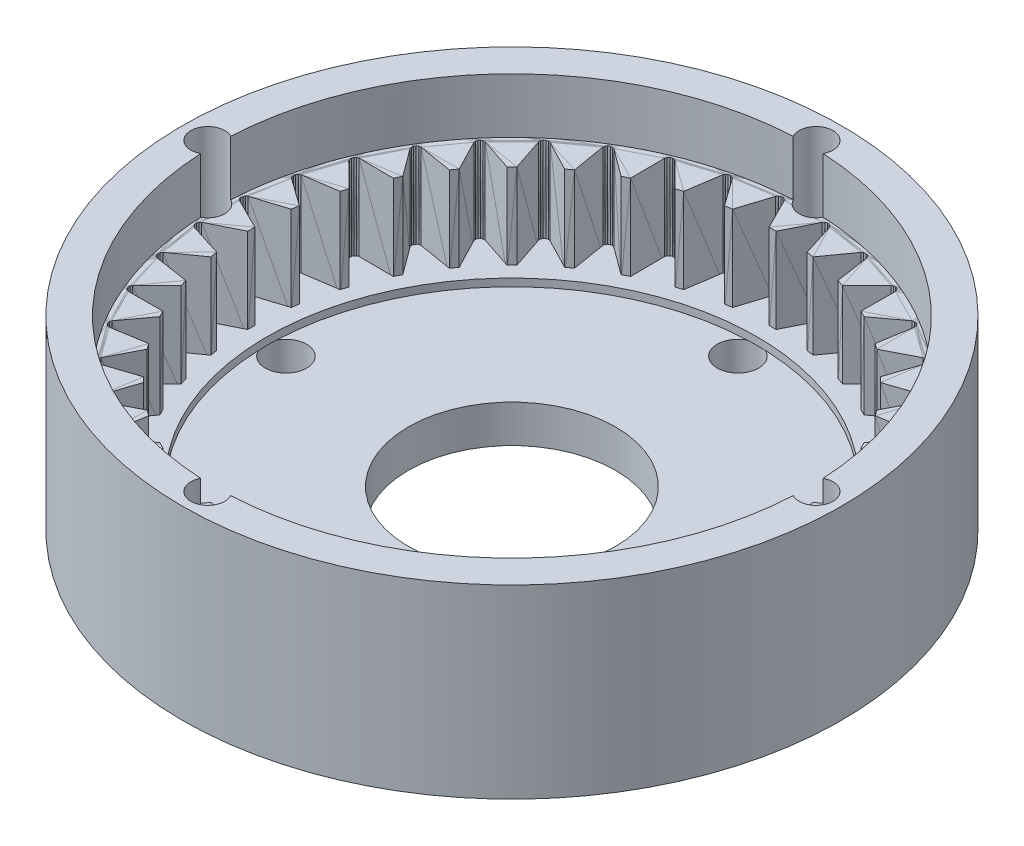
from build123d import *

# Parameters (mm, degrees)
SCALE_1_DEPTH            = 9.842519648
SKETCH_2_R               = 35
SKETCH_2_R_2             = 31.5
EXTRUDE_1_DEPTH          = 15.7
SKETCH_3_R               = 35
SKETCH_3_R_2             = 26
EXTRUDE_2_DEPTH          = 0.8
EXTRUDE_START            = -4
SKETCH_4_R               = 35
SKETCH_4_R_2             = 11
EXTRUDE_3_DEPTH          = 4
CUT_EXTRUDE_4_DEPTH      = 52.927738252
CUT_EXTRUDE_4_DEPTH_BACK = 52.927738252
SKETCH_5_R               = 1.8
SKETCH_7_R               = 2.2
CUT_EXTRUDE_5_DEPTH      = 4


with BuildPart() as part:
    # 缩放比例1: read off the stored shape, not the designer's step
    # 缩放比例1 outline → 缩放比例1 (new body)
    with BuildSketch(Plane(origin=(0, 0, 0), x_dir=(1, 0, 0), z_dir=(0, 1, 0))):
        Polygon((-28.350821231, 19.569159485), (-34.197649802, 4.152346446), (-32.210204517, -12.215718743), (-22.843792976, -25.785312755), (-8.244141645, -33.447798342), (8.244141645, -33.447798342), (22.843792976, -25.785312755), (32.210204517, -12.215718743), (34.44882168, 0), (34.197649802, 4.152346446), (28.350821231, 19.569159485), (16.009164392, 30.502915615), (0, 34.44882168), (-16.009164392, 30.502915615), align=None)
        Polygon((-31.149413553, -2.34892741), (-31.080524786, -2.156340997), (-30.938786222, -2.0088768), (-27.679521008, -0.37684556), (-27.679521008, 0.37684556), (-30.938786222, 2.0088768), (-31.080524786, 2.156340997), (-31.149413553, 2.34892741), (-31.133368611, 2.552833939), (-31.03519557, 2.732272333), (-30.87213554, 2.855748244), (-27.397691156, 3.957825174), (-27.279788628, 4.702237129), (-30.243620859, 6.824036973), (-30.360545497, 6.99185839), (-30.398461968, 7.192850171), (-30.350711313, 7.391735562), (-30.225681257, 7.553608157), (-30.045313179, 7.650056068), (-26.441240334, 8.1950413), (-26.208336931, 8.911843906), (-28.803755413, 11.471166363), (-28.892990667, 11.655213166), (-28.898994788, 11.859661026), (-28.820722946, 12.048629287), (-28.67190924, 12.18894904), (-28.478674358, 12.255992624), (-24.833719363, 12.230467109), (-24.491551449, 12.902010349), (-26.654649992, 15.835837985), (-26.713989791, 16.031577252), (-26.687941863, 16.234448412), (-26.581072598, 16.408844385), (-26.412139414, 16.524156672), (-26.210793294, 16.560147924), (-22.61470654, 15.964740305), (-22.17169822, 16.574488836), (-23.849216814, 19.810578669), (-23.877207423, 20.013190806), (-23.819741909, 20.209490322), (-23.686904751, 20.365021192), (-23.502012482, 20.452485478), (-23.297517328, 20.456536731), (-19.83884722, 19.305906608), (-19.305906608, 19.83884722), (-20.456536731, 23.297517328), (-20.452485478, 23.502012482), (-20.365021192, 23.686904751), (-20.209490322, 23.819741909), (-20.013190806, 23.877207423), (-19.810578669, 23.849216814), (-16.574488836, 22.17169822), (-15.964740305, 22.61470654), (-16.560147924, 26.210793294), (-16.524156672, 26.412139414), (-16.408844385, 26.581072598), (-16.234448412, 26.687941863), (-16.031577252, 26.713989791), (-15.835837985, 26.654649992), (-12.902010349, 24.491551449), (-12.230467109, 24.833719363), (-12.255992624, 28.478674358), (-12.18894904, 28.67190924), (-12.048629287, 28.820722946), (-11.859661026, 28.898994788), (-11.655213166, 28.892990667), (-11.471166363, 28.803755413), (-8.911843906, 26.208336931), (-8.1950413, 26.441240334), (-7.650056068, 30.045313179), (-7.553608157, 30.225681257), (-7.391735562, 30.350711313), (-7.192850171, 30.398461968), (-6.99185839, 30.360545497), (-6.824036973, 30.243620859), (-4.702237129, 27.279788628), (-3.957825174, 27.397691156), (-2.855748244, 30.87213554), (-2.732272333, 31.03519557), (-2.552833939, 31.133368611), (-2.34892741, 31.149413553), (-2.156340997, 31.080524786), (-2.0088768, 30.938786222), (-0.37684556, 27.679521008), (0.37684556, 27.679521008), (2.0088768, 30.938786222), (2.156340997, 31.080524786), (2.34892741, 31.149413553), (2.552833939, 31.133368611), (2.732272333, 31.03519557), (2.855748244, 30.87213554), (3.957825174, 27.397691156), (4.702237129, 27.279788628), (6.824036973, 30.243620859), (6.99185839, 30.360545497), (7.192850171, 30.398461968), (7.391735562, 30.350711313), (7.553608157, 30.225681257), (7.650056068, 30.045313179), (8.1950413, 26.441240334), (8.911843906, 26.208336931), (11.471166363, 28.803755413), (11.655213166, 28.892990667), (11.859661026, 28.898994788), (12.048629287, 28.820722946), (12.18894904, 28.67190924), (12.255992624, 28.478674358), (12.230467109, 24.833719363), (12.902010349, 24.491551449), (15.835837985, 26.654649992), (16.031577252, 26.713989791), (16.234448412, 26.687941863), (16.408844385, 26.581072598), (16.524156672, 26.412139414), (16.560147924, 26.210793294), (15.964740305, 22.61470654), (16.574488836, 22.17169822), (19.810578669, 23.849216814), (20.013190806, 23.877207423), (20.209490322, 23.819741909), (20.365021192, 23.686904751), (20.452485478, 23.502012482), (20.456536731, 23.297517328), (19.305906608, 19.83884722), (19.83884722, 19.305906608), (23.297517328, 20.456536731), (23.502012482, 20.452485478), (23.686904751, 20.365021192), (23.819741909, 20.209490322), (23.877207423, 20.013190806), (23.849216814, 19.810578669), (22.17169822, 16.574488836), (22.61470654, 15.964740305), (26.210793294, 16.560147924), (26.412139414, 16.524156672), (26.581072598, 16.408844385), (26.687941863, 16.234448412), (26.713989791, 16.031577252), (26.654649992, 15.835837985), (24.491551449, 12.902010349), (24.833719363, 12.230467109), (28.478674358, 12.255992624), (28.67190924, 12.18894904), (28.820722946, 12.048629287), (28.898994788, 11.859661026), (28.892990667, 11.655213166), (28.803755413, 11.471166363), (26.208336931, 8.911843906), (26.441240334, 8.1950413), (30.045313179, 7.650056068), (30.225681257, 7.553608157), (30.350711313, 7.391735562), (30.398461968, 7.192850171), (30.360545497, 6.99185839), (30.243620859, 6.824036973), (27.279788628, 4.702237129), (27.397691156, 3.957825174), (30.87213554, 2.855748244), (31.03519557, 2.732272333), (31.133368611, 2.552833939), (31.149413553, 2.34892741), (31.080524786, 2.156340997), (30.938786222, 2.0088768), (27.679521008, 0.37684556), (27.679521008, -0.37684556), (30.938786222, -2.0088768), (31.080524786, -2.156340997), (31.149413553, -2.34892741), (31.133368611, -2.552833939), (31.03519557, -2.732272333), (30.87213554, -2.855748244), (27.397691156, -3.957825174), (27.279788628, -4.702237129), (30.243620859, -6.824036973), (30.360545497, -6.99185839), (30.398461968, -7.192850171), (30.350711313, -7.391735562), (30.225681257, -7.553608157), (30.045313179, -7.650056068), (26.441240334, -8.1950413), (26.208336931, -8.911843906), (28.803755413, -11.471166363), (28.892990667, -11.655213166), (28.898994788, -11.859661026), (28.820722946, -12.048629287), (28.67190924, -12.18894904), (28.478674358, -12.255992624), (24.833719363, -12.230467109), (24.491551449, -12.902010349), (26.654649992, -15.835837985), (26.713989791, -16.031577252), (26.687941863, -16.234448412), (26.581072598, -16.408844385), (26.412139414, -16.524156672), (26.210793294, -16.560147924), (22.61470654, -15.964740305), (22.17169822, -16.574488836), (23.849216814, -19.810578669), (23.877207423, -20.013190806), (23.819741909, -20.209490322), (23.686904751, -20.365021192), (23.502012482, -20.452485478), (23.297517328, -20.456536731), (19.83884722, -19.305906608), (19.305906608, -19.83884722), (20.456536731, -23.297517328), (20.452485478, -23.502012482), (20.365021192, -23.686904751), (20.209490322, -23.819741909), (20.013190806, -23.877207423), (19.810578669, -23.849216814), (16.574488836, -22.17169822), (15.964740305, -22.61470654), (16.560147924, -26.210793294), (16.524156672, -26.412139414), (16.408844385, -26.581072598), (16.234448412, -26.687941863), (16.031577252, -26.713989791), (15.835837985, -26.654649992), (12.902010349, -24.491551449), (12.230467109, -24.833719363), (12.255992624, -28.478674358), (12.18894904, -28.67190924), (12.048629287, -28.820722946), (11.859661026, -28.898994788), (11.655213166, -28.892990667), (11.471166363, -28.803755413), (8.911843906, -26.208336931), (8.1950413, -26.441240334), (7.650056068, -30.045313179), (7.553608157, -30.225681257), (7.391735562, -30.350711313), (7.192850171, -30.398461968), (6.99185839, -30.360545497), (6.824036973, -30.243620859), (4.702237129, -27.279788628), (3.957825174, -27.397691156), (2.855748244, -30.87213554), (2.732272333, -31.03519557), (2.552833939, -31.133368611), (2.34892741, -31.149413553), (2.156340997, -31.080524786), (2.0088768, -30.938786222), (0.37684556, -27.679521008), (-0.37684556, -27.679521008), (-2.0088768, -30.938786222), (-2.156340997, -31.080524786), (-2.34892741, -31.149413553), (-2.552833939, -31.133368611), (-2.732272333, -31.03519557), (-2.855748244, -30.87213554), (-3.957825174, -27.397691156), (-4.702237129, -27.279788628), (-6.824036973, -30.243620859), (-6.99185839, -30.360545497), (-7.192850171, -30.398461968), (-7.391735562, -30.350711313), (-7.553608157, -30.225681257), (-7.650056068, -30.045313179), (-8.1950413, -26.441240334), (-8.911843906, -26.208336931), (-11.471166363, -28.803755413), (-11.655213166, -28.892990667), (-11.859661026, -28.898994788), (-12.048629287, -28.820722946), (-12.18894904, -28.67190924), (-12.255992624, -28.478674358), (-12.230467109, -24.833719363), (-12.902010349, -24.491551449), (-15.835837985, -26.654649992), (-16.031577252, -26.713989791), (-16.234448412, -26.687941863), (-16.408844385, -26.581072598), (-16.524156672, -26.412139414), (-16.560147924, -26.210793294), (-15.964740305, -22.61470654), (-16.574488836, -22.17169822), (-19.810578669, -23.849216814), (-20.013190806, -23.877207423), (-20.209490322, -23.819741909), (-20.365021192, -23.686904751), (-20.452485478, -23.502012482), (-20.456536731, -23.297517328), (-19.305906608, -19.83884722), (-19.83884722, -19.305906608), (-23.297517328, -20.456536731), (-23.502012482, -20.452485478), (-23.686904751, -20.365021192), (-23.819741909, -20.209490322), (-23.877207423, -20.013190806), (-23.849216814, -19.810578669), (-22.17169822, -16.574488836), (-22.61470654, -15.964740305), (-26.210793294, -16.560147924), (-26.412139414, -16.524156672), (-26.581072598, -16.408844385), (-26.687941863, -16.234448412), (-26.713989791, -16.031577252), (-26.654649992, -15.835837985), (-24.491551449, -12.902010349), (-24.833719363, -12.230467109), (-28.478674358, -12.255992624), (-28.67190924, -12.18894904), (-28.820722946, -12.048629287), (-28.898994788, -11.859661026), (-28.892990667, -11.655213166), (-28.803755413, -11.471166363), (-26.208336931, -8.911843906), (-26.441240334, -8.1950413), (-30.045313179, -7.650056068), (-30.225681257, -7.553608157), (-30.350711313, -7.391735562), (-30.398461968, -7.192850171), (-30.360545497, -6.99185839), (-30.243620859, -6.824036973), (-27.279788628, -4.702237129), (-27.397691156, -3.957825174), (-30.87213554, -2.855748244), (-31.03519557, -2.732272333), (-31.133368611, -2.552833939), align=None, mode=Mode.SUBTRACT)
    extrude(amount=SCALE_1_DEPTH)

    # 草图2 → 凸台-拉伸1 (add)
    with BuildSketch(Plane(origin=(0, 0, 0), x_dir=(1, 0, 0), z_dir=(0, 1, 0))):
        with Locations(Location((0, 0, 0), (0, 0, 270))):
            Circle(SKETCH_2_R)
        with Locations(Location((0, 0, 0), (0, 0, 86.88011013))):
            Circle(SKETCH_2_R_2, mode=Mode.SUBTRACT)
    extrude(amount=EXTRUDE_1_DEPTH)

    # 草图3 → 凸台-拉伸2 (add)
    with BuildSketch(Plane(origin=(0, 0, 0), x_dir=(1, 0, 0), z_dir=(0, 1, 0))):
        with Locations(Location((0, 0, 0), (0, 0, 270))):
            Circle(SKETCH_3_R)
        with Locations(Location((0, 0, 0), (0, 0, 270))):
            Circle(SKETCH_3_R_2, mode=Mode.SUBTRACT)
    extrude(amount=EXTRUDE_2_DEPTH)

    # 草图4 → 凸台-拉伸3 (add)
    with BuildSketch(Plane(origin=(0, 0, 0), x_dir=(1, 0, 0), z_dir=(0, 1, 0)).offset(EXTRUDE_START)):
        with Locations(Location((0, 0, 0), (0, 0, 270))):
            Circle(SKETCH_4_R)
        with Locations(Location((0, 0, 0), (0, 0, 270))):
            Circle(SKETCH_4_R_2, mode=Mode.SUBTRACT)
    extrude(amount=EXTRUDE_3_DEPTH)

    # 草图5 → 切除-拉伸4 (cut, two sides: drawn at the far end of the back side and taken through both)
    with BuildSketch(Plane(origin=(0, 0, 0), x_dir=(1, 0, 0), z_dir=(0, 1, 0)).offset(-CUT_EXTRUDE_4_DEPTH_BACK)):
        with Locations(Location((-32.3, 0, 0), (0, 0, 270))):
            Circle(SKETCH_5_R)
        with Locations(Location((0, 32.3, 0), (0, 0, 270))):
            Circle(SKETCH_5_R)
        with Locations(Location((32.3, 0, 0), (0, 0, 270))):
            Circle(SKETCH_5_R)
        with Locations(Location((0, -32.3, 0), (0, 0, 270))):
            Circle(SKETCH_5_R)
    extrude(amount=CUT_EXTRUDE_4_DEPTH + CUT_EXTRUDE_4_DEPTH_BACK, mode=Mode.SUBTRACT)

    # 草图7 → 切除-拉伸5 (cut)
    with BuildSketch(Plane.XZ.offset(4)):
        with Locations(Location((-32.3, 0, 0), (0, 0, 270))):
            Circle(SKETCH_7_R)
        with Locations(Location((32.3, 0, 0), (0, 0, 270))):
            Circle(SKETCH_7_R)
        with Locations(Location((0, 32.3, 0), (0, 0, 270))):
            Circle(SKETCH_7_R)
        with Locations(Location((0, -32.3, 0), (0, 0, 270))):
            Circle(SKETCH_7_R)
        with Locations(Location((-24, 0, 0), (0, 0, 270))):
            Circle(SKETCH_7_R)
        with Locations(Location((0, 24, 0), (0, 0, 270))):
            Circle(SKETCH_7_R)
        with Locations(Location((24, 0, 0), (0, 0, 270))):
            Circle(SKETCH_7_R)
        with Locations(Location((0, -24, 0), (0, 0, 270))):
            Circle(SKETCH_7_R)
    extrude(amount=-CUT_EXTRUDE_5_DEPTH, mode=Mode.SUBTRACT)


solid = part.part
